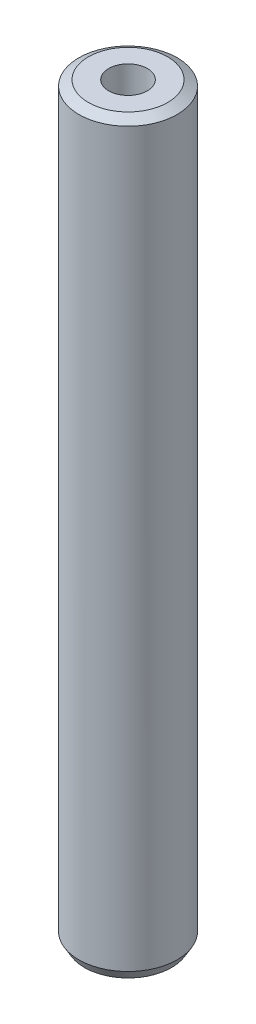
from build123d import *
from OCP.BRepFilletAPI import BRepFilletAPI_MakeChamfer

# Parameters (mm, degrees)
SKETCH1_R           = 27.5
BOSS_EXTRUDE1_DEPTH = 417.847683624
SKETCH2_R           = 10.823938453
CUT_EXTRUDE1_DEPTH  = 420.653650896
CHAMFER1_SIZE       = 3.121838461
CHAMFER1_SIZE2      = 5.345545212


with BuildPart() as part:
    # Sketch1 → Boss-Extrude1 (new body)
    with BuildSketch(Plane(origin=(0, 0, 0), x_dir=(1, 0, 0), z_dir=(0, 1, 0))):
        Circle(SKETCH1_R)
    extrude(amount=BOSS_EXTRUDE1_DEPTH)

    # Sketch2 → Cut-Extrude1 (cut, through all)
    with BuildSketch(Plane(origin=(0, 0, 0), x_dir=(1, 0, 0), z_dir=(0, 1, 0))):
        Circle(SKETCH2_R)
    extrude(amount=CUT_EXTRUDE1_DEPTH, mode=Mode.SUBTRACT)

    # Chamfer1: one chamfer whose edges measure the first distance from different faces: ONE call of the kernel's chamfer builder (chamfer() names one face for all edges)
    chamfer1_edges_1 = [part.edges().sort_by_distance(p)[0] for p in [
        (-27.5, 417.847683624, 0),
    ]]
    chamfer1_side_1 = [part.faces().sort_by_distance(p)[0] for p in [
        (-27.5, 208.923841812, 0),
    ]]
    chamfer1_edges_2 = [part.edges().sort_by_distance(p)[0] for p in [
        (-27.5, 0, 0),
    ]]
    chamfer1_side_2 = [part.faces().sort_by_distance(p)[0] for p in [
        (-26.722182541, 0, 0),
    ]]
    chamfer1 = BRepFilletAPI_MakeChamfer(part.part.solid().wrapped)
    for e in chamfer1_edges_1:
        chamfer1.Add(CHAMFER1_SIZE, CHAMFER1_SIZE2, e.wrapped, chamfer1_side_1[0].wrapped)  # the first distance lies on this face
    for e in chamfer1_edges_2:
        chamfer1.Add(CHAMFER1_SIZE, CHAMFER1_SIZE2, e.wrapped, chamfer1_side_2[0].wrapped)  # the first distance lies on this face
    add(Compound.cast(chamfer1.Shape()), mode=Mode.REPLACE)


solid = part.part
